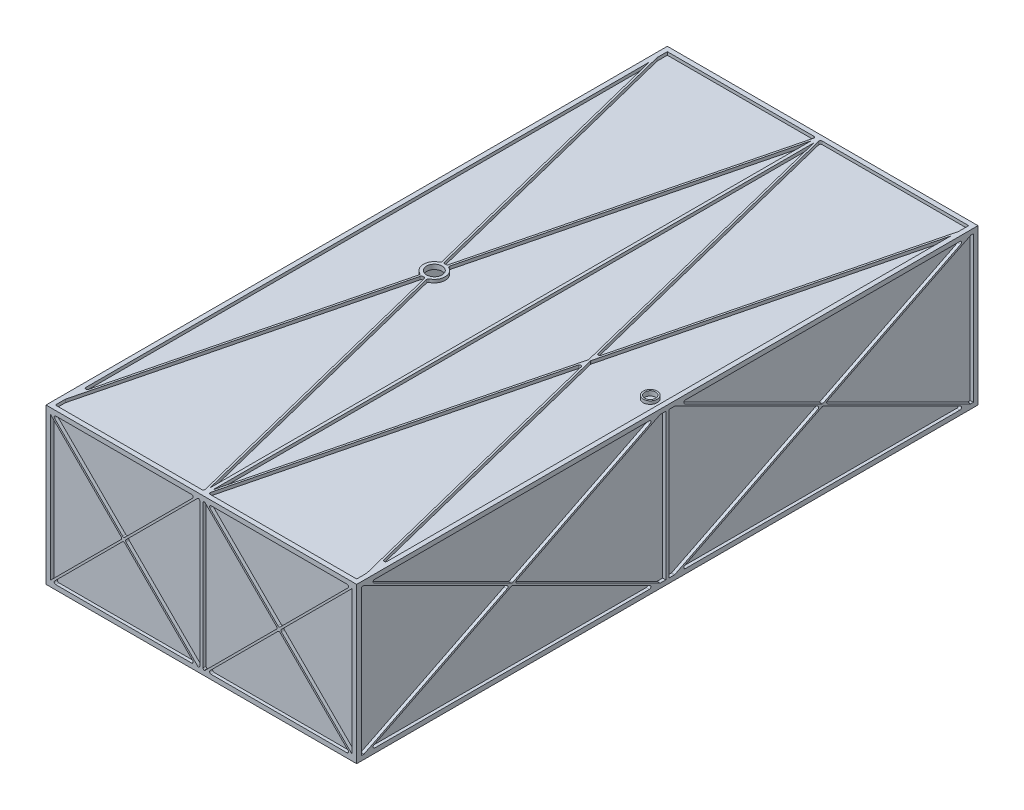
from build123d import *

# Parameters (mm, degrees)
SKETCH1_W              = 1000
SKETCH1_H              = 2000
BOSS_EXTRUDE1_DEPTH    = 500
SKETCH2_W              = 970
SKETCH2_H              = 470
CUT_EXTRUDE1_DEPTH     = 2122.32034356
SKETCH3_W              = 1970
SKETCH3_H              = 470
CUT_EXTRUDE2_DEPTH     = 1501
SKETCH4_W              = 970
SKETCH4_H              = 1970
CUT_EXTRUDE3_DEPTH     = 1225.744871392
SKETCH8_W              = 970
SKETCH8_H              = 1970
BOSS_EXTRUDE3_DEPTH    = 5
SKETCH9_W              = 970
SKETCH9_H              = 1970
BOSS_EXTRUDE4_DEPTH    = 5
SKETCH10_W             = 970
SKETCH10_H             = 470
BOSS_EXTRUDE5_DEPTH    = 5
SKETCH11_W             = 970
SKETCH11_H             = 470
BOSS_EXTRUDE6_DEPTH    = 5
SKETCH12_W             = 1970
SKETCH12_H             = 470
BOSS_EXTRUDE7_DEPTH    = 5
SKETCH13_W             = 1970
SKETCH13_H             = 470
BOSS_EXTRUDE8_DEPTH    = 5
BOSS_EXTRUDE9_DEPTH    = 10
BOSS_EXTRUDE10_DEPTH   = 10
SKETCH16_R             = 22.5
SKETCH16_R_2           = 17.5
SKETCH16_R_3           = 25
BOSS_EXTRUDE11_DEPTH   = 10
FILLET2_R              = 5
FILLET5_R              = 5
FILLET6_R              = 5
MIRROR1_START          = 990
MIRROR1_DEPTH          = 10
FILLET5_OF_MIRROR2_R   = 5
LPATTERN1_COUNT        = 2
LPATTERN1_PITCH        = 490
FILLET6_OF_LPATTERN1_R = 5
BOSS_EXTRUDE12_DEPTH   = 5
SKETCH20_R             = 17.5
SKETCH20_R_2           = 25
CUT_EXTRUDE4_DEPTH     = 1225.744871392


# Read off the part's stored shape, not the designer's step: Mirror1
with BuildPart() as part:
    # Sketch1 → Boss-Extrude1 (new body)
    with BuildSketch(Plane(origin=(0, 0, 0), x_dir=(1, 0, 0), z_dir=(0, 1, 0))):
        Rectangle(SKETCH1_W, SKETCH1_H)
    extrude(amount=BOSS_EXTRUDE1_DEPTH)

    # Sketch2 → Cut-Extrude1 (cut, through all)
    with BuildSketch(Plane.XY.offset(1000)):
        with Locations((0, 250)):
            Rectangle(SKETCH2_W, SKETCH2_H)
    extrude(amount=-CUT_EXTRUDE1_DEPTH, mode=Mode.SUBTRACT)

    # Sketch3 → Cut-Extrude2 (cut, through all)
    with BuildSketch(Plane.ZY.offset(500)):
        with Locations((0, 250)):
            Rectangle(SKETCH3_W, SKETCH3_H)
    extrude(amount=-CUT_EXTRUDE2_DEPTH, mode=Mode.SUBTRACT)

    # Sketch4 → Cut-Extrude3 (cut, through all)
    with BuildSketch(Plane(origin=(0, 500, 0), x_dir=(1, 0, 0), z_dir=(0, 1, 0))):
        Rectangle(SKETCH4_W, SKETCH4_H)
    extrude(amount=-CUT_EXTRUDE3_DEPTH, mode=Mode.SUBTRACT)

    # Sketch8 → Boss-Extrude3 (add)
    with BuildSketch(Plane.XZ.offset(-485)):
        Rectangle(SKETCH8_W, SKETCH8_H)
    extrude(amount=-BOSS_EXTRUDE3_DEPTH)

    # Sketch9 → Boss-Extrude4 (add)
    with BuildSketch(Plane(origin=(0, 15, 0), x_dir=(1, 0, 0), z_dir=(0, 1, 0))):
        Rectangle(SKETCH9_W, SKETCH9_H)
    extrude(amount=-BOSS_EXTRUDE4_DEPTH)

    # Sketch10 → Boss-Extrude5 (add)
    with BuildSketch(Plane.XY.offset(-985)):
        with Locations((0, 250)):
            Rectangle(SKETCH10_W, SKETCH10_H)
    extrude(amount=-BOSS_EXTRUDE5_DEPTH)

    # Sketch11 → Boss-Extrude6 (add)
    with BuildSketch(Plane(origin=(0, 0, 985), x_dir=(-1, 0, 0), z_dir=(0, 0, -1))):
        with Locations((0, 250)):
            Rectangle(SKETCH11_W, SKETCH11_H)
    extrude(amount=-BOSS_EXTRUDE6_DEPTH)

    # Sketch12 → Boss-Extrude7 (add)
    with BuildSketch(Plane(origin=(-485, 0, 0), x_dir=(0, 0, -1), z_dir=(1, 0, 0))):
        with Locations((0, 250)):
            Rectangle(SKETCH12_W, SKETCH12_H)
    extrude(amount=-BOSS_EXTRUDE7_DEPTH)

    # Sketch13 → Boss-Extrude8 (add)
    with BuildSketch(Plane.ZY.offset(-485)):
        with Locations((0, 250)):
            Rectangle(SKETCH13_W, SKETCH13_H)
    extrude(amount=-BOSS_EXTRUDE8_DEPTH)

    # Sketch14 → Boss-Extrude9 (add)
    with BuildSketch(Plane(origin=(0, 0, -990), x_dir=(-1, 0, 0), z_dir=(0, 0, -1))):
        Polygon((-495.757359313, 0), (-250, 245.757359313), (-4.242640687, 0), (4.242640687, 0), (250, 245.757359313), (495.757359313, 0), (500, 0), (500, 4.242640687), (254.242640687, 250), (500, 495.757359313), (500, 500), (495.757359313, 500), (250, 254.242640687), (4.242640687, 500), (-4.242640687, 500), (-250, 254.242640687), (-495.757359313, 500), (-500, 500), (-500, 495.757359313), (-254.242640687, 250), (-500, 4.242640687), (-500, 0), align=None)
        Polygon((5, 490.757359313), (245.757359313, 250), (5, 9.242640687), align=None, mode=Mode.SUBTRACT)
        Polygon((-245.757359313, 250), (-5, 490.757359313), (-5, 9.242640687), align=None, mode=Mode.SUBTRACT)
    extrude(amount=BOSS_EXTRUDE9_DEPTH)

    # Sketch15 → Boss-Extrude10 (add)
    with BuildSketch(Plane(origin=(490, 0, 0), x_dir=(0, 0, -1), z_dir=(1, 0, 0))):
        Polygon((-1000, 496.645898034), (-506.708203932, 250), (-1000, 3.354101966), (-1000, 0), (-993.291796068, 0), (-500, 246.645898034), (-6.708203932, 0), (6.708203932, 0), (500, 246.645898034), (993.291796068, 0), (1000, 0), (1000, 3.354101966), (506.708203932, 250), (1000, 496.645898034), (1000, 500), (993.291796068, 500), (500, 253.354101966), (6.708203932, 500), (-6.708203932, 500), (-500, 253.354101966), (-993.291796068, 500), (-1000, 500), align=None)
        Polygon((5, 494.145898034), (493.291796068, 250), (5, 5.854101966), align=None, mode=Mode.SUBTRACT)
        Polygon((-493.291796068, 250), (-5, 5.854101966), (-5, 494.145898034), align=None, mode=Mode.SUBTRACT)
    boss_extrude10 = extrude(amount=BOSS_EXTRUDE10_DEPTH)

    # Sketch16 → Boss-Extrude11 (add)
    # profile 1 of 2: a face of its own
    with BuildSketch(Plane(origin=(0, 490, 0), x_dir=(1, 0, 0), z_dir=(0, 1, 0))):
        with Locations(Location((445, 0, 0), (0, 0, 270))):
            Circle(SKETCH16_R)
        with Locations(Location((445, 0, 0), (0, 0, 270))):
            Circle(SKETCH16_R_2, mode=Mode.SUBTRACT)
    # profile 2 of 2: a face of its own
    with BuildSketch(Plane(origin=(0, 490, 0), x_dir=(1, 0, 0), z_dir=(0, 1, 0))):
        with BuildLine():
            Line((496.907670781, 1000), (250, 12.369316877))
            Line((250, 12.369316877), (3.092329219, 1000))
            Line((3.092329219, 1000), (-3.092329219, 1000))
            Line((-3.092329219, 1000), (-244.452921263, 34.557631827))
            ThreePointArc((-244.452921263, 34.557631827), (-250, 35), (-255.547078737, 34.557631827))
            Line((-255.547078737, 34.557631827), (-496.907670781, 1000))
            Line((-496.907670781, 1000), (-500, 1000))
            Line((-500, 1000), (-500, 987.630683123))
            Line((-500, 987.630683123), (-261.367933738, 33.102418077))
            ThreePointArc((-261.367933738, 33.102418077), (-285, 0), (-261.367933738, -33.102418077))
            Line((-261.367933738, -33.102418077), (-500, -987.630683123))
            Line((-500, -987.630683123), (-500, -1000))
            Line((-500, -1000), (-496.907670781, -1000))
            Line((-496.907670781, -1000), (-255.547078737, -34.557631827))
            ThreePointArc((-255.547078737, -34.557631827), (-250, -35), (-244.452921263, -34.557631827))
            Line((-244.452921263, -34.557631827), (-3.092329219, -1000))
            Line((-3.092329219, -1000), (3.092329219, -1000))
            Line((3.092329219, -1000), (250, -12.369316877))
            Line((250, -12.369316877), (496.907670781, -1000))
            Line((496.907670781, -1000), (500, -1000))
            Line((500, -1000), (500, -987.630683123))
            Line((500, -987.630683123), (253.092329219, 0))
            Line((253.092329219, 0), (500, 987.630683123))
            Line((500, 987.630683123), (500, 1000))
            Line((500, 1000), (496.907670781, 1000))
        make_face()
        with Locations(Location((-250, 0, 0), (0, 0, 270))):
            Circle(SKETCH16_R_3, mode=Mode.SUBTRACT)
        with BuildLine():
            Line((-5, -967.630683123), (-238.632066262, -33.102418077))
            ThreePointArc((-238.632066262, -33.102418077), (-215, 0), (-238.632066262, 33.102418077))
            Line((-238.632066262, 33.102418077), (-5, 967.630683123))
            Line((-5, 967.630683123), (-5, -967.630683123))
        make_face(mode=Mode.SUBTRACT)
        Polygon((5, 967.630683123), (246.907670781, 0), (5, -967.630683123), align=None, mode=Mode.SUBTRACT)
    boss_extrude11 = extrude(amount=BOSS_EXTRUDE11_DEPTH)

    # Fillet2
    # the kernel refuses this fillet: 5 mm, written as the material it adds along each edge
    with BuildSketch(Plane(origin=(480.757359313, 15, -1000), x_dir=(-0.7071067811865542, 0.7071067811865407, 0), z_dir=(0, 0, 1))) as fillet2_piece_1_section:
        with BuildLine():
            CenterArc((FILLET2_R * 2.41421356237, FILLET2_R), FILLET2_R, 135, 135)
            Line((FILLET2_R * 1.70710678119, FILLET2_R * 1.70710678119), (0, 0))
            Line((0, 0), (FILLET2_R * 2.41421356237, 0))
        make_face()
    fillet2_piece_1 = extrude(amount=40.17766953, mode=Mode.PRIVATE)
    fillet2_piece_1 = split(fillet2_piece_1, bisect_by=Plane(origin=(475.393958173, 17.221593493, -985), z_dir=(0, 0, -1)), keep=Keep.TOP, mode=Mode.PRIVATE)
    add(fillet2_piece_1)
    with BuildSketch(Plane(origin=(19.242640687, 15, -959.82233047), x_dir=(0.7071067811865464, 0.7071067811865487, 0), z_dir=(0, 0, -1))) as fillet2_piece_2_section:
        with BuildLine():
            CenterArc((FILLET2_R * 2.41421356237, FILLET2_R), FILLET2_R, 135, 135)
            Line((FILLET2_R * 1.70710678119, FILLET2_R * 1.70710678119), (0, 0))
            Line((0, 0), (FILLET2_R * 2.41421356237, 0))
        make_face()
    fillet2_piece_2 = extrude(amount=40.17766953, mode=Mode.PRIVATE)
    fillet2_piece_2 = split(fillet2_piece_2, bisect_by=Plane(origin=(24.606041827, 17.221593493, -985), z_dir=(0, 0, -1)), keep=Keep.TOP, mode=Mode.PRIVATE)
    add(fillet2_piece_2)
    with BuildSketch(Plane(origin=(250, 245.757359313, -977.5), x_dir=(-0.7071067811865476, -0.7071067811865476, 0), z_dir=(0, 0, -1))) as fillet2_piece_3_section:
        with BuildLine():
            CenterArc((FILLET2_R, -FILLET2_R), FILLET2_R, 90, 90)
            Line((0, -FILLET2_R), (0, 0))
            Line((0, 0), (FILLET2_R, 0))
        make_face()
    fillet2_piece_3 = extrude(amount=22.5, mode=Mode.PRIVATE)
    fillet2_piece_3 = split(fillet2_piece_3, bisect_by=Plane(origin=(250, 244.17790947, -985), z_dir=(0, 0, -1)), keep=Keep.TOP, mode=Mode.PRIVATE)
    add(fillet2_piece_3)
    with BuildSketch(Plane(origin=(-19.242640687, 15, -1000), x_dir=(-0.707106781186549, 0.7071067811865459, 0), z_dir=(0, 0, 1))) as fillet2_piece_4_section:
        with BuildLine():
            CenterArc((FILLET2_R * 2.41421356237, FILLET2_R), FILLET2_R, 135, 135)
            Line((FILLET2_R * 1.70710678119, FILLET2_R * 1.70710678119), (0, 0))
            Line((0, 0), (FILLET2_R * 2.41421356237, 0))
        make_face()
    fillet2_piece_4 = extrude(amount=40.17766953, mode=Mode.PRIVATE)
    fillet2_piece_4 = split(fillet2_piece_4, bisect_by=Plane(origin=(-24.606041827, 17.221593493, -985), z_dir=(0, 0, -1)), keep=Keep.TOP, mode=Mode.PRIVATE)
    add(fillet2_piece_4)
    with BuildSketch(Plane(origin=(-480.757359313, 15, -959.82233047), x_dir=(0.7071067811865481, 0.707106781186547, 0), z_dir=(0, 0, -1))) as fillet2_piece_5_section:
        with BuildLine():
            CenterArc((FILLET2_R * 2.41421356237, FILLET2_R), FILLET2_R, 135, 135)
            Line((FILLET2_R * 1.70710678119, FILLET2_R * 1.70710678119), (0, 0))
            Line((0, 0), (FILLET2_R * 2.41421356237, 0))
        make_face()
    fillet2_piece_5 = extrude(amount=40.17766953, mode=Mode.PRIVATE)
    fillet2_piece_5 = split(fillet2_piece_5, bisect_by=Plane(origin=(-475.393958173, 17.221593493, -985), z_dir=(0, 0, -1)), keep=Keep.TOP, mode=Mode.PRIVATE)
    add(fillet2_piece_5)
    with BuildSketch(Plane(origin=(-250, 245.757359313, -977.5), x_dir=(-0.7071067811865476, -0.7071067811865476, 0), z_dir=(0, 0, -1))) as fillet2_piece_6_section:
        with BuildLine():
            CenterArc((FILLET2_R, -FILLET2_R), FILLET2_R, 90, 90)
            Line((0, -FILLET2_R), (0, 0))
            Line((0, 0), (FILLET2_R, 0))
        make_face()
    fillet2_piece_6 = extrude(amount=22.5, mode=Mode.PRIVATE)
    fillet2_piece_6 = split(fillet2_piece_6, bisect_by=Plane(origin=(-250, 244.17790947, -985), z_dir=(0, 0, -1)), keep=Keep.TOP, mode=Mode.PRIVATE)
    add(fillet2_piece_6)
    with BuildSketch(Plane(origin=(-254.242640687, 250, -977.5), x_dir=(-0.7071067811865475, -0.7071067811865475, 0), z_dir=(0, 0, -1))) as fillet2_piece_7_section:
        with BuildLine():
            CenterArc((FILLET2_R, FILLET2_R), FILLET2_R, 180, 90)
            Line((0, FILLET2_R), (0, 0))
            Line((0, 0), (FILLET2_R, 0))
        make_face()
    fillet2_piece_7 = extrude(amount=22.5, mode=Mode.PRIVATE)
    fillet2_piece_7 = split(fillet2_piece_7, bisect_by=Plane(origin=(-255.82209053, 250, -985), z_dir=(0, 0, -1)), keep=Keep.TOP, mode=Mode.PRIVATE)
    add(fillet2_piece_7)
    with BuildSketch(Plane(origin=(-480.757359313, 485, -1000), x_dir=(0.7071067811865523, -0.7071067811865429, 0), z_dir=(0, 0, 1))) as fillet2_piece_8_section:
        with BuildLine():
            CenterArc((FILLET2_R * 2.41421356237, FILLET2_R), FILLET2_R, 135, 135)
            Line((FILLET2_R * 1.70710678119, FILLET2_R * 1.70710678119), (0, 0))
            Line((0, 0), (FILLET2_R * 2.41421356237, 0))
        make_face()
    fillet2_piece_8 = extrude(amount=40.17766953, mode=Mode.PRIVATE)
    fillet2_piece_8 = split(fillet2_piece_8, bisect_by=Plane(origin=(-475.393958173, 482.778406507, -985), z_dir=(0, 0, -1)), keep=Keep.TOP, mode=Mode.PRIVATE)
    add(fillet2_piece_8)
    with BuildSketch(Plane(origin=(-19.242640687, 485, -959.82233047), x_dir=(-1, 0, 0), z_dir=(0, 0, -1))) as fillet2_piece_9_section:
        with BuildLine():
            CenterArc((FILLET2_R * 2.41421356237, -FILLET2_R), FILLET2_R, 90, 135)
            Line((FILLET2_R * 1.70710678119, -FILLET2_R * 1.70710678119), (0, 0))
            Line((0, 0), (FILLET2_R * 2.41421356237, 0))
        make_face()
    fillet2_piece_9 = extrude(amount=40.17766953, mode=Mode.PRIVATE)
    fillet2_piece_9 = split(fillet2_piece_9, bisect_by=Plane(origin=(-24.606041827, 482.778406507, -985), z_dir=(0, 0, -1)), keep=Keep.TOP, mode=Mode.PRIVATE)
    add(fillet2_piece_9)
    with BuildSketch(Plane(origin=(-250, 254.242640687, -977.5), x_dir=(-0.7071067811865476, 0.7071067811865476, 0), z_dir=(0, 0, -1))) as fillet2_piece_10_section:
        with BuildLine():
            CenterArc((FILLET2_R, FILLET2_R), FILLET2_R, 180, 90)
            Line((0, FILLET2_R), (0, 0))
            Line((0, 0), (FILLET2_R, 0))
        make_face()
    fillet2_piece_10 = extrude(amount=22.5, mode=Mode.PRIVATE)
    fillet2_piece_10 = split(fillet2_piece_10, bisect_by=Plane(origin=(-250, 255.82209053, -985), z_dir=(0, 0, -1)), keep=Keep.TOP, mode=Mode.PRIVATE)
    add(fillet2_piece_10)
    with BuildSketch(Plane(origin=(19.242640687, 485, -1000), x_dir=(0.7071067811865506, -0.7071067811865447, 0), z_dir=(0, 0, 1))) as fillet2_piece_11_section:
        with BuildLine():
            CenterArc((FILLET2_R * 2.41421356237, FILLET2_R), FILLET2_R, 135, 135)
            Line((FILLET2_R * 1.70710678119, FILLET2_R * 1.70710678119), (0, 0))
            Line((0, 0), (FILLET2_R * 2.41421356237, 0))
        make_face()
    fillet2_piece_11 = extrude(amount=40.17766953, mode=Mode.PRIVATE)
    fillet2_piece_11 = split(fillet2_piece_11, bisect_by=Plane(origin=(24.606041827, 482.778406507, -985), z_dir=(0, 0, -1)), keep=Keep.TOP, mode=Mode.PRIVATE)
    add(fillet2_piece_11)
    with BuildSketch(Plane(origin=(480.757359313, 485, -959.82233047), x_dir=(-1, 0, 0), z_dir=(0, 0, -1))) as fillet2_piece_12_section:
        with BuildLine():
            CenterArc((FILLET2_R * 2.41421356237, -FILLET2_R), FILLET2_R, 90, 135)
            Line((FILLET2_R * 1.70710678119, -FILLET2_R * 1.70710678119), (0, 0))
            Line((0, 0), (FILLET2_R * 2.41421356237, 0))
        make_face()
    fillet2_piece_12 = extrude(amount=40.17766953, mode=Mode.PRIVATE)
    fillet2_piece_12 = split(fillet2_piece_12, bisect_by=Plane(origin=(475.393958173, 482.778406507, -985), z_dir=(0, 0, -1)), keep=Keep.TOP, mode=Mode.PRIVATE)
    add(fillet2_piece_12)
    with BuildSketch(Plane(origin=(250, 254.242640687, -977.5), x_dir=(-0.7071067811865476, 0.7071067811865476, 0), z_dir=(0, 0, -1))) as fillet2_piece_13_section:
        with BuildLine():
            CenterArc((FILLET2_R, FILLET2_R), FILLET2_R, 180, 90)
            Line((0, FILLET2_R), (0, 0))
            Line((0, 0), (FILLET2_R, 0))
        make_face()
    fillet2_piece_13 = extrude(amount=22.5, mode=Mode.PRIVATE)
    fillet2_piece_13 = split(fillet2_piece_13, bisect_by=Plane(origin=(250, 255.82209053, -985), z_dir=(0, 0, -1)), keep=Keep.TOP, mode=Mode.PRIVATE)
    add(fillet2_piece_13)
    with BuildSketch(Plane(origin=(254.242640687, 250, -977.5), x_dir=(0.7071067811865475, 0.7071067811865475, 0), z_dir=(0, 0, -1))) as fillet2_piece_14_section:
        with BuildLine():
            CenterArc((FILLET2_R, FILLET2_R), FILLET2_R, 180, 90)
            Line((0, FILLET2_R), (0, 0))
            Line((0, 0), (FILLET2_R, 0))
        make_face()
    fillet2_piece_14 = extrude(amount=22.5, mode=Mode.PRIVATE)
    fillet2_piece_14 = split(fillet2_piece_14, bisect_by=Plane(origin=(255.82209053, 250, -985), z_dir=(0, 0, -1)), keep=Keep.TOP, mode=Mode.PRIVATE)
    add(fillet2_piece_14)
    with BuildSketch(Plane(origin=(5, 15, -977.5), x_dir=(1, 0, 0), z_dir=(0, 0, -1))) as fillet2_piece_15_section:
        with BuildLine():
            CenterArc((FILLET2_R, -FILLET2_R), FILLET2_R, 90, 90)
            Line((0, -FILLET2_R), (0, 0))
            Line((0, 0), (FILLET2_R, 0))
        make_face()
    fillet2_piece_15 = extrude(amount=22.5, mode=Mode.PRIVATE)
    fillet2_piece_15 = split(fillet2_piece_15, bisect_by=Plane(origin=(6.116839695, 16.116839695, -985), z_dir=(0, 0, -1)), keep=Keep.TOP, mode=Mode.PRIVATE)
    add(fillet2_piece_15)
    with BuildSketch(Plane(origin=(245.757359313, 250, -977.5), x_dir=(-0.7071067811865476, -0.7071067811865476, 0), z_dir=(0, 0, -1))) as fillet2_piece_16_section:
        with BuildLine():
            CenterArc((FILLET2_R, FILLET2_R), FILLET2_R, 180, 90)
            Line((0, FILLET2_R), (0, 0))
            Line((0, 0), (FILLET2_R, 0))
        make_face()
    fillet2_piece_16 = extrude(amount=22.5, mode=Mode.PRIVATE)
    fillet2_piece_16 = split(fillet2_piece_16, bisect_by=Plane(origin=(244.17790947, 250, -985), z_dir=(0, 0, -1)), keep=Keep.TOP, mode=Mode.PRIVATE)
    add(fillet2_piece_16)
    with BuildSketch(Plane(origin=(-245.757359313, 250, -977.5), x_dir=(0.7071067811865476, 0.7071067811865476, 0), z_dir=(0, 0, -1))) as fillet2_piece_17_section:
        with BuildLine():
            CenterArc((FILLET2_R, FILLET2_R), FILLET2_R, 180, 90)
            Line((0, FILLET2_R), (0, 0))
            Line((0, 0), (FILLET2_R, 0))
        make_face()
    fillet2_piece_17 = extrude(amount=22.5, mode=Mode.PRIVATE)
    fillet2_piece_17 = split(fillet2_piece_17, bisect_by=Plane(origin=(-244.17790947, 250, -985), z_dir=(0, 0, -1)), keep=Keep.TOP, mode=Mode.PRIVATE)
    add(fillet2_piece_17)
    with BuildSketch(Plane(origin=(-5, 15, -1000), x_dir=(0, 1, 0), z_dir=(0, 0, 1))) as fillet2_piece_18_section:
        with BuildLine():
            CenterArc((FILLET2_R, FILLET2_R), FILLET2_R, 180, 90)
            Line((0, FILLET2_R), (0, 0))
            Line((0, 0), (FILLET2_R, 0))
        make_face()
    fillet2_piece_18 = extrude(amount=22.5, mode=Mode.PRIVATE)
    fillet2_piece_18 = split(fillet2_piece_18, bisect_by=Plane(origin=(-6.116839695, 16.116839695, -985), z_dir=(0, 0, -1)), keep=Keep.TOP, mode=Mode.PRIVATE)
    add(fillet2_piece_18)
    with BuildSketch(Plane(origin=(10.757359313, 15, -1000), x_dir=(0.7071067811865372, 0.7071067811865578, 0), z_dir=(0, 0, 1))) as fillet2_piece_19_section:
        with BuildLine():
            CenterArc((FILLET2_R * 0.414213562373, FILLET2_R), FILLET2_R, 225, 45)
            Line((-FILLET2_R * 0.292893218813, FILLET2_R * 0.292893218813), (0, 0))
            Line((0, 0), (FILLET2_R * 0.414213562373, 0))
        make_face()
    fillet2_piece_19 = extrude(amount=15.17766953, mode=Mode.PRIVATE)
    fillet2_piece_19 = split(fillet2_piece_19, bisect_by=Plane(origin=(10.632753067, 15.300826089, -985), z_dir=(0, 0, -1)), keep=Keep.TOP, mode=Mode.PRIVATE)
    add(fillet2_piece_19)
    with BuildSketch(Plane(origin=(5, 485, -1000), x_dir=(0, -1, 0), z_dir=(0, 0, 1))) as fillet2_piece_20_section:
        with BuildLine():
            CenterArc((FILLET2_R, FILLET2_R), FILLET2_R, 180, 90)
            Line((0, FILLET2_R), (0, 0))
            Line((0, 0), (FILLET2_R, 0))
        make_face()
    fillet2_piece_20 = extrude(amount=22.5, mode=Mode.PRIVATE)
    fillet2_piece_20 = split(fillet2_piece_20, bisect_by=Plane(origin=(6.116839695, 483.883160305, -985), z_dir=(0, 0, -1)), keep=Keep.TOP, mode=Mode.PRIVATE)
    add(fillet2_piece_20)
    with BuildSketch(Plane(origin=(10.757359313, 485, -984.82233047), x_dir=(-1, 0, 0), z_dir=(0, 0, -1))) as fillet2_piece_21_section:
        with BuildLine():
            CenterArc((FILLET2_R * 0.414213562373, -FILLET2_R), FILLET2_R, 90, 45)
            Line((-FILLET2_R * 0.292893218813, -FILLET2_R * 0.292893218813), (0, 0))
            Line((0, 0), (FILLET2_R * 0.414213562373, 0))
        make_face()
    fillet2_piece_21 = extrude(amount=15.17766953, mode=Mode.PRIVATE)
    fillet2_piece_21 = split(fillet2_piece_21, bisect_by=Plane(origin=(10.632753067, 484.699173911, -985), z_dir=(0, 0, -1)), keep=Keep.TOP, mode=Mode.PRIVATE)
    add(fillet2_piece_21)
    with BuildSketch(Plane(origin=(-10.757359313, 15, -984.82233047), x_dir=(1, 0, 0), z_dir=(0, 0, -1))) as fillet2_piece_22_section:
        with BuildLine():
            CenterArc((FILLET2_R * 0.414213562373, -FILLET2_R), FILLET2_R, 90, 45)
            Line((-FILLET2_R * 0.292893218813, -FILLET2_R * 0.292893218813), (0, 0))
            Line((0, 0), (FILLET2_R * 0.414213562373, 0))
        make_face()
    fillet2_piece_22 = extrude(amount=15.17766953, mode=Mode.PRIVATE)
    fillet2_piece_22 = split(fillet2_piece_22, bisect_by=Plane(origin=(-10.632753067, 15.300826089, -985), z_dir=(0, 0, -1)), keep=Keep.TOP, mode=Mode.PRIVATE)
    add(fillet2_piece_22)
    with BuildSketch(Plane(origin=(-10.757359313, 485, -1000), x_dir=(-0.7071067811865158, -0.7071067811865793, 0), z_dir=(0, 0, 1))) as fillet2_piece_23_section:
        with BuildLine():
            CenterArc((FILLET2_R * 0.414213562373, FILLET2_R), FILLET2_R, 225, 45)
            Line((-FILLET2_R * 0.292893218813, FILLET2_R * 0.292893218813), (0, 0))
            Line((0, 0), (FILLET2_R * 0.414213562373, 0))
        make_face()
    fillet2_piece_23 = extrude(amount=15.17766953, mode=Mode.PRIVATE)
    fillet2_piece_23 = split(fillet2_piece_23, bisect_by=Plane(origin=(-10.632753067, 484.699173911, -985), z_dir=(0, 0, -1)), keep=Keep.TOP, mode=Mode.PRIVATE)
    add(fillet2_piece_23)
    with BuildSketch(Plane(origin=(-5, 485, -977.5), x_dir=(-1, 0, 0), z_dir=(0, 0, -1))) as fillet2_piece_24_section:
        with BuildLine():
            CenterArc((FILLET2_R, -FILLET2_R), FILLET2_R, 90, 90)
            Line((0, -FILLET2_R), (0, 0))
            Line((0, 0), (FILLET2_R, 0))
        make_face()
    fillet2_piece_24 = extrude(amount=22.5, mode=Mode.PRIVATE)
    fillet2_piece_24 = split(fillet2_piece_24, bisect_by=Plane(origin=(-6.116839695, 483.883160305, -985), z_dir=(0, 0, -1)), keep=Keep.TOP, mode=Mode.PRIVATE)
    add(fillet2_piece_24)

    # Fillet5
    fillet5_edges = [part.edges().sort_by_distance(p)[0] for p in [
        (495, 15, 963.291796068),
        (495, 15, 36.708203932),
        (495, 246.645898034, 500),
        (495, 15, -36.708203932),
        (495, 15, -963.291796067),
        (495, 246.645898034, -500),
        (495, 250, -506.708203932),
        (495, 485, -963.291796068),
        (495, 485, -36.708203932),
        (495, 253.354101966, -500),
        (495, 485, 36.708203932),
        (495, 485, 963.291796068),
        (495, 253.354101966, 500),
        (495, 250, 506.708203932),
        (495, 250, 493.291796068),
        (495, 250, -493.291796068),
        (495, 485, 23.291796068),
        (495, 15, 23.291796068),
        (495, 15, -23.291796068),
        (495, 485, -23.291796068),
    ]]
    fillet(fillet5_edges, radius=FILLET5_R)

    # Fillet6
    fillet6_edges = [part.edges().sort_by_distance(p)[0] for p in [
        (-485, 495, 927.630683123),
        (-261.367933738, 495, 33.102418077),
        (-6.842329219, 495, 985),
        (-244.452921263, 495, 34.557631827),
        (6.842329219, 495, 985),
        (250, 495, 12.369316877),
        (485, 495, 927.630683123),
        (253.092329219, 495, 0),
        (6.842329219, 495, -985),
        (250, 495, -12.369316877),
        (-6.842329219, 495, -985),
        (-255.547078737, 495, -34.557631827),
        (-261.367933738, 495, -33.102418077),
        (-255.547078737, 495, 34.557631827),
        (-244.452921263, 495, -34.557631827),
        (246.907670781, 495, 0),
        (-238.632066262, 495, -33.102418077),
        (-238.632066262, 495, 33.102418077),
    ]]
    fillet(fillet6_edges, radius=FILLET6_R)

    # Mirror1 outline → Mirror1 (add)
    with BuildSketch(Plane.XY.offset(MIRROR1_START)):
        with BuildLine():
            ThreePointArc((-468.686291501, 15), (-473.305689164, 18.086582838), (-472.221825407, 23.535533906))
            Line((-472.221825407, 23.535533906), (-253.535533906, 242.221825407))
            ThreePointArc((-253.535533906, 242.221825407), (-250, 243.686291501), (-246.464466094, 242.221825407))
            Line((-246.464466094, 242.221825407), (-27.778174593, 23.535533906))
            ThreePointArc((-27.778174593, 23.535533906), (-26.694310836, 18.086582838), (-31.313708499, 15))
            Line((-31.313708499, 15), (31.313708499, 15))
            ThreePointArc((31.313708499, 15), (26.694310836, 18.086582838), (27.778174593, 23.535533906))
            Line((27.778174593, 23.535533906), (246.464466094, 242.221825407))
            ThreePointArc((246.464466094, 242.221825407), (250, 243.686291501), (253.535533906, 242.221825407))
            Line((253.535533906, 242.221825407), (472.221825407, 23.535533906))
            ThreePointArc((472.221825407, 23.535533906), (473.305689164, 18.086582838), (468.686291501, 15))
            Line((468.686291501, 15), (485, 15))
            Line((485, 15), (485, 19.242640687))
            Line((485, 19.242640687), (257.778174593, 246.464466094))
            ThreePointArc((257.778174593, 246.464466094), (256.313708499, 250), (257.778174593, 253.535533906))
            Line((257.778174593, 253.535533906), (485, 480.757359313))
            Line((485, 480.757359313), (485, 485))
            Line((485, 485), (468.686291501, 485))
            ThreePointArc((468.686291501, 485), (473.305689164, 481.913417162), (472.221825407, 476.464466094))
            Line((472.221825407, 476.464466094), (253.535533906, 257.778174593))
            ThreePointArc((253.535533906, 257.778174593), (250, 256.313708499), (246.464466094, 257.778174593))
            Line((246.464466094, 257.778174593), (27.778174593, 476.464466094))
            ThreePointArc((27.778174593, 476.464466094), (26.694310836, 481.913417162), (31.313708499, 485))
            Line((31.313708499, 485), (-31.313708499, 485))
            ThreePointArc((-31.313708499, 485), (-26.694310836, 481.913417162), (-27.778174593, 476.464466094))
            Line((-27.778174593, 476.464466094), (-246.464466094, 257.778174593))
            ThreePointArc((-246.464466094, 257.778174593), (-250, 256.313708499), (-253.535533906, 257.778174593))
            Line((-253.535533906, 257.778174593), (-472.221825407, 476.464466094))
            ThreePointArc((-472.221825407, 476.464466094), (-473.305689164, 481.913417162), (-468.686291501, 485))
            Line((-468.686291501, 485), (-485, 485))
            Line((-485, 485), (-485, 480.757359313))
            Line((-485, 480.757359313), (-257.778174593, 253.535533906))
            ThreePointArc((-257.778174593, 253.535533906), (-256.313708499, 250), (-257.778174593, 246.464466094))
            Line((-257.778174593, 246.464466094), (-485, 19.242640687))
            Line((-485, 19.242640687), (-485, 15))
            Line((-485, 15), (-468.686291501, 15))
        make_face()
        with BuildLine():
            Line((-5, 480), (-5, 20))
            ThreePointArc((-5, 20), (-6.239396907, 16.704872631), (-9.343145751, 15.04333353))
            ThreePointArc((-9.343145751, 15.04333353), (-10.899645077, 15.516578768), (-12.221825407, 16.464466094))
            Line((-12.221825407, 16.464466094), (-242.221825407, 246.464466094))
            ThreePointArc((-242.221825407, 246.464466094), (-243.686291501, 250), (-242.221825407, 253.535533906))
            Line((-242.221825407, 253.535533906), (-12.221825407, 483.535533906))
            ThreePointArc((-12.221825407, 483.535533906), (-10.899645077, 484.483421232), (-9.343145751, 484.95666647))
            ThreePointArc((-9.343145751, 484.95666647), (-6.239396907, 483.295127369), (-5, 480))
        make_face(mode=Mode.SUBTRACT)
        with BuildLine():
            Line((5, 20), (5, 480))
            ThreePointArc((5, 480), (6.239396907, 483.295127369), (9.343145751, 484.95666647))
            ThreePointArc((9.343145751, 484.95666647), (10.899645077, 484.483421232), (12.221825407, 483.535533906))
            Line((12.221825407, 483.535533906), (242.221825407, 253.535533906))
            ThreePointArc((242.221825407, 253.535533906), (243.686291501, 250), (242.221825407, 246.464466094))
            Line((242.221825407, 246.464466094), (12.221825407, 16.464466094))
            ThreePointArc((12.221825407, 16.464466094), (10.899645077, 15.516578768), (9.343145751, 15.04333353))
            ThreePointArc((9.343145751, 15.04333353), (6.239396907, 16.704872631), (5, 20))
        make_face(mode=Mode.SUBTRACT)
    extrude(amount=MIRROR1_DEPTH)

    # Mirror2: Boss-Extrude10 across plane
    add(boss_extrude10.mirror(Plane(origin=(0, 0, 0), x_dir=(0, 0, 1), z_dir=(1, 0, 0))))

    # Fillet5 of Mirror2
    fillet5_of_mirror2_edges = [part.edges().sort_by_distance(p)[0] for p in [
        (-495, 15, 963.291796068),
        (-495, 15, 36.708203932),
        (-495, 246.645898034, 500),
        (-495, 15, -36.708203932),
        (-495, 15, -963.291796067),
        (-495, 246.645898034, -500),
        (-495, 250, -506.708203932),
        (-495, 485, -963.291796068),
        (-495, 485, -36.708203932),
        (-495, 253.354101966, -500),
        (-495, 485, 36.708203932),
        (-495, 485, 963.291796068),
        (-495, 253.354101966, 500),
        (-495, 250, 506.708203932),
        (-495, 250, 493.291796068),
        (-495, 250, -493.291796068),
        (-495, 485, 23.291796068),
        (-495, 15, 23.291796068),
        (-495, 15, -23.291796068),
        (-495, 485, -23.291796068),
    ]]
    fillet(fillet5_of_mirror2_edges, radius=FILLET5_OF_MIRROR2_R)

    # LPattern1: Boss-Extrude11 ×2
    with Locations(*[(0, -i * LPATTERN1_PITCH, 0) for i in range(1, LPATTERN1_COUNT)]):
        add(boss_extrude11)

    # Fillet6 of LPattern1
    fillet6_of_lpattern1_edges = [part.edges().sort_by_distance(p)[0] for p in [
        (-485, 5, 927.630683123),
        (-261.367933738, 5, 33.102418077),
        (-6.842329219, 5, 985),
        (-244.452921263, 5, 34.557631827),
        (6.842329219, 5, 985),
        (250, 5, 12.369316877),
        (485, 5, 927.630683123),
        (253.092329219, 5, 0),
        (6.842329219, 5, -985),
        (250, 5, -12.369316877),
        (-6.842329219, 5, -985),
        (-255.547078737, 5, -34.557631827),
        (-261.367933738, 5, -33.102418077),
        (-255.547078737, 5, 34.557631827),
        (-244.452921263, 5, -34.557631827),
        (246.907670781, 5, 0),
        (-238.632066262, 5, -33.102418077),
        (-238.632066262, 5, 33.102418077),
    ]]
    fillet(fillet6_of_lpattern1_edges, radius=FILLET6_OF_LPATTERN1_R)

    # Sketch17 → Boss-Extrude12 (add, symmetric)
    with BuildSketch(Plane(origin=(0, 0, 0), x_dir=(0, 0, -1), z_dir=(1, 0, 0))):
        Polygon((-1000, 496.645898034), (-506.708203932, 250), (-1000, 3.354101966), (-1000, 0), (-993.291796068, 0), (-500, 246.645898034), (-6.708203932, 0), (6.708203933, 0), (500, 246.645898034), (993.291796068, 0), (1000, 0), (1000, 3.354101966), (506.708203932, 250), (1000, 496.645898034), (1000, 500), (993.291796068, 500), (500, 253.354101966), (6.708203932, 500), (-6.708203933, 500), (-500, 253.354101966), (-993.291796068, 500), (-1000, 500), align=None)
        Polygon((5, 5.854101966), (493.291796068, 250), (5, 494.145898034), align=None, mode=Mode.SUBTRACT)
        Polygon((-5, 494.145898034), (-493.291796068, 250), (-5, 5.854101966), align=None, mode=Mode.SUBTRACT)
    extrude(amount=BOSS_EXTRUDE12_DEPTH, both=True)

    # Sketch20 → Cut-Extrude4 (cut, through all)
    with BuildSketch(Plane(origin=(0, 500, 0), x_dir=(1, 0, 0), z_dir=(0, 1, 0))):
        with Locations(Location((445, 0, 0), (0, 0, 180))):
            Circle(SKETCH20_R)
        with Locations(Location((-250, 0, 0), (0, 0, 180))):
            Circle(SKETCH20_R_2)
    extrude(amount=-CUT_EXTRUDE4_DEPTH, mode=Mode.SUBTRACT)


solid = part.part
